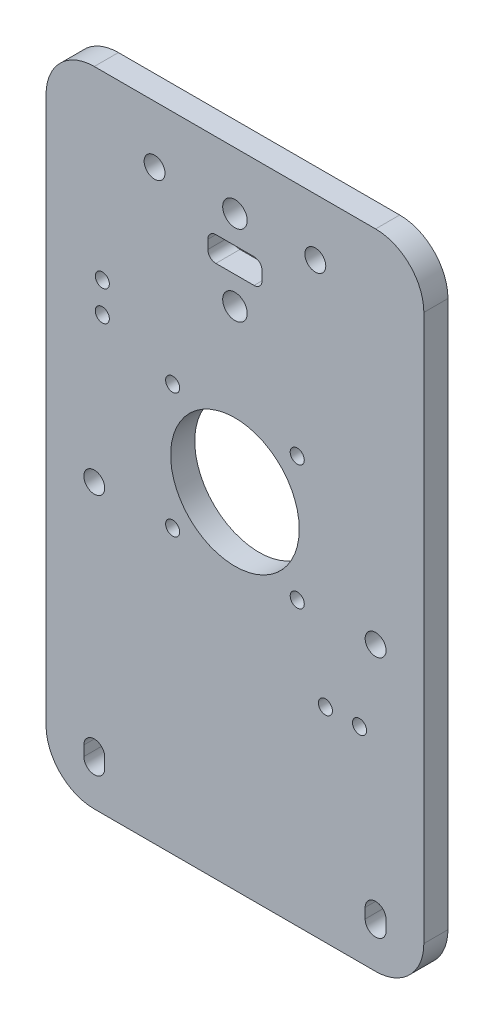
from build123d import *

# Parameters (mm, degrees)
MODEL_R           = 2.6
MODEL_R_2         = 1.75
MODEL_R_3         = 16
MODEL_R_4         = 3.05
MODEL_W           = 13.5
MODEL_H           = 6.2
BASE_DEPTH        = 6
SKETCH1_R         = 1.75
SENSORMOUNT_DEPTH = 10
SKETCH2_R         = 1.75
CABLEMOUNT_DEPTH  = 10
FILLETCABLESLOT_R = 2


with BuildPart() as part:
    # Model → Base (new body)
    with BuildSketch(Plane.XY):
        with BuildLine():
            Line((35, 160), (-35, 160))
            ThreePointArc((-35, 160), (-43.485281374, 156.485281374), (-47, 148))
            Line((-47, 148), (-47, 12))
            ThreePointArc((-47, 12), (-43.485281374, 3.514718626), (-35, 0))
            Line((-35, 0), (35, 0))
            ThreePointArc((35, 0), (43.485281374, 3.514718626), (47, 12))
            Line((47, 12), (47, 148))
            ThreePointArc((47, 148), (43.485281374, 156.485281374), (35, 160))
        make_face()
        with BuildLine():
            ThreePointArc((-37.6, 12.5), (-35, 15.1), (-32.4, 12.5))
            Line((-32.4, 12.5), (-32.4, 10))
            ThreePointArc((-32.4, 10), (-35, 7.4), (-37.6, 10))
            Line((-37.6, 10), (-37.6, 12.5))
        make_face(mode=Mode.SUBTRACT)
        with Locations((-35, 70.45)):
            Circle(MODEL_R, mode=Mode.SUBTRACT)
        with Locations((-15.5, 70.3)):
            Circle(MODEL_R_2, mode=Mode.SUBTRACT)
        with BuildLine():
            Line((32.4, 10), (32.4, 12.5))
            ThreePointArc((32.4, 12.5), (35, 15.1), (37.6, 12.5))
            Line((37.6, 12.5), (37.6, 10))
            ThreePointArc((37.6, 10), (35, 7.4), (32.4, 10))
        make_face(mode=Mode.SUBTRACT)
        with Locations((15.5, 70.3)):
            Circle(MODEL_R_2, mode=Mode.SUBTRACT)
        with Locations((35, 70.45)):
            Circle(MODEL_R, mode=Mode.SUBTRACT)
        with Locations((-15.5, 101.3)):
            Circle(MODEL_R_2, mode=Mode.SUBTRACT)
        with Locations((-20, 145.8)):
            Circle(MODEL_R, mode=Mode.SUBTRACT)
        with Locations((0, 85.8)):
            Circle(MODEL_R_3, mode=Mode.SUBTRACT)
        with Locations((15.5, 101.3)):
            Circle(MODEL_R_2, mode=Mode.SUBTRACT)
        with Locations((0, 125.8)):
            Circle(MODEL_R_4, mode=Mode.SUBTRACT)
        with Locations((0, 135.8)):
            Rectangle(MODEL_W, MODEL_H, mode=Mode.SUBTRACT)
        with Locations((0, 145.8)):
            Circle(MODEL_R_4, mode=Mode.SUBTRACT)
        with Locations((20, 145.8)):
            Circle(MODEL_R, mode=Mode.SUBTRACT)
    extrude(amount=BASE_DEPTH)

    # Sketch1 → SensorMount (cut)
    with BuildSketch(Plane.XY.offset(6)):
        with Locations((-33, 115)):
            Circle(SKETCH1_R)
        with Locations((-33, 107.5)):
            Circle(SKETCH1_R)
    extrude(amount=-SENSORMOUNT_DEPTH, mode=Mode.SUBTRACT)

    # Sketch2 → CableMount (cut)
    with BuildSketch(Plane.XY.offset(6)):
        with Locations((22.5, 50.76)):
            Circle(SKETCH2_R)
        with Locations((31, 50.76)):
            Circle(SKETCH2_R)
    extrude(amount=-CABLEMOUNT_DEPTH, mode=Mode.SUBTRACT)

    # FilletCableSlot
    filletcableslot_edges = [part.edges().sort_by_distance(p)[0] for p in [
        (6.75, 138.9, 3),
        (-6.75, 138.9, 3),
        (-6.75, 132.7, 3),
        (6.75, 132.7, 3),
    ]]
    fillet(filletcableslot_edges, radius=FILLETCABLESLOT_R)


solid = part.part
